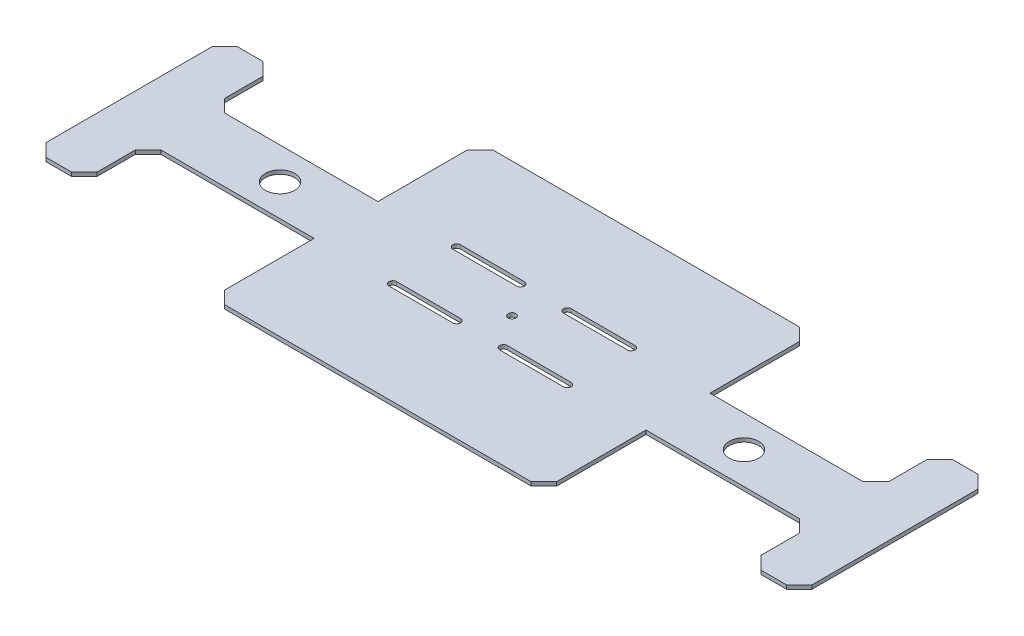
from build123d import *

# Parameters (mm, degrees)
SKETCH1_R           = 11.5
SKETCH1_R_2         = 3
BOSS_EXTRUDE1_DEPTH = 3


with BuildPart() as part:
    # Sketch1 → Boss-Extrude1 (new body)
    with BuildSketch(Plane(origin=(0, 0, 0), x_dir=(1, 0, 0), z_dir=(0, 1, 0))):
        Polygon((10, 150), (30, 150), (40, 140), (40, 110), (50, 100), (170, 100), (170, 170), (180, 180), (420, 180), (430, 170), (430, 100), (550, 100), (560, 110), (560, 140), (570, 150), (590, 150), (600, 140), (600, 10), (590, 0), (570, 0), (560, 10), (560, 40), (550, 50), (430, 50), (430, -20), (420, -30), (180, -30), (170, -20), (170, 50), (50, 50), (40, 40), (40, 10), (30, 0), (10, 0), (0, 10), (0, 140), align=None)
        with Locations(Location((118.3, 75, 0), (0, 0, 270))):
            Circle(SKETCH1_R, mode=Mode.SUBTRACT)
        with Locations(Location((481.7, 75, 0), (0, 0, 270))):
            Circle(SKETCH1_R, mode=Mode.SUBTRACT)
        with Locations(Location((300, 75, 0), (0, 0, 270))):
            Circle(SKETCH1_R_2, mode=Mode.SUBTRACT)
        with BuildLine():
            Line((231.666666667, 103), (281.666666667, 103))
            ThreePointArc((281.666666667, 103), (284.666666667, 100), (281.666666667, 97))
            Line((281.666666667, 97), (231.666666667, 97))
            ThreePointArc((231.666666667, 97), (228.666666667, 100), (231.666666667, 103))
        make_face(mode=Mode.SUBTRACT)
        with BuildLine():
            Line((318.333333333, 103), (368.333333333, 103))
            ThreePointArc((368.333333333, 103), (371.333333333, 100), (368.333333333, 97))
            Line((368.333333333, 97), (318.333333333, 97))
            ThreePointArc((318.333333333, 97), (315.333333333, 100), (318.333333333, 103))
        make_face(mode=Mode.SUBTRACT)
        with BuildLine():
            Line((231.666666667, 53), (281.666666667, 53))
            ThreePointArc((281.666666667, 53), (284.666666667, 50), (281.666666667, 47))
            Line((281.666666667, 47), (231.666666667, 47))
            ThreePointArc((231.666666667, 47), (228.666666667, 50), (231.666666667, 53))
        make_face(mode=Mode.SUBTRACT)
        with BuildLine():
            Line((318.333333333, 53), (368.333333333, 53))
            ThreePointArc((368.333333333, 53), (371.333333333, 50), (368.333333333, 47))
            Line((368.333333333, 47), (318.333333333, 47))
            ThreePointArc((318.333333333, 47), (315.333333333, 50), (318.333333333, 53))
        make_face(mode=Mode.SUBTRACT)
    extrude(amount=BOSS_EXTRUDE1_DEPTH)


solid = part.part
